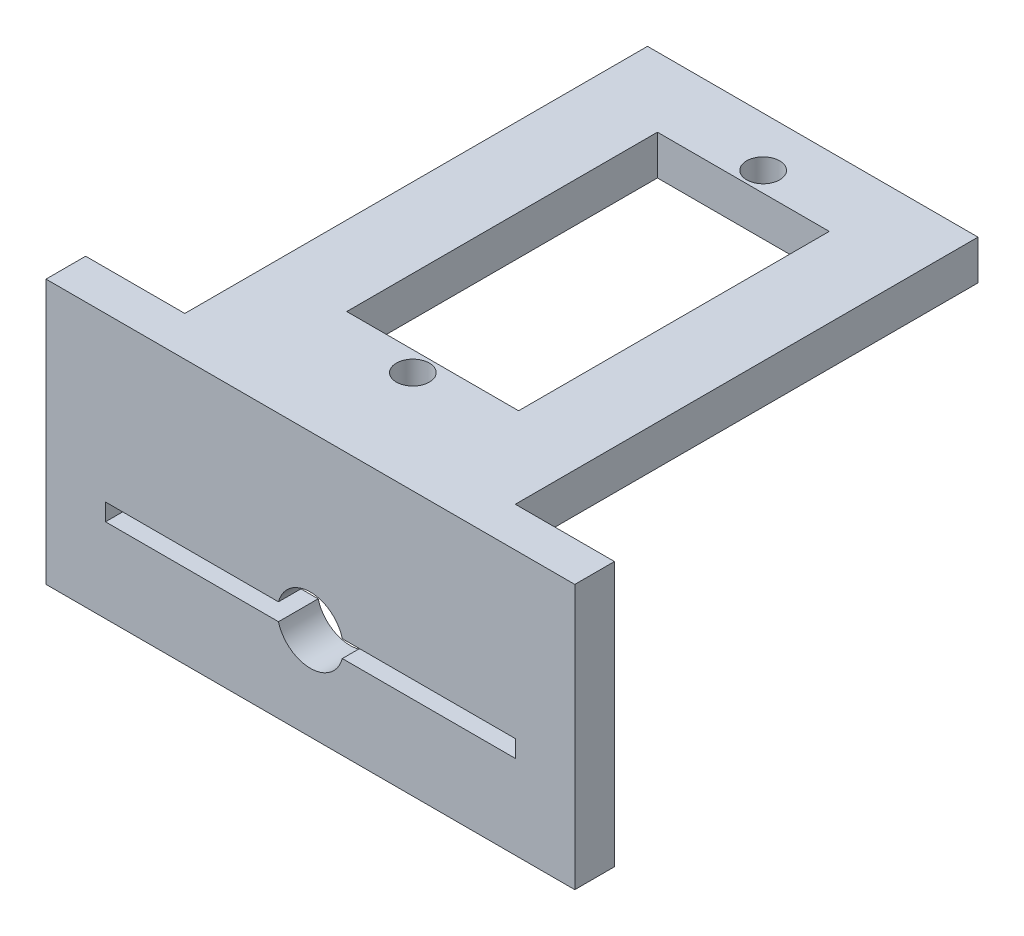
from build123d import *

# Parameters (mm, degrees)
ESBO_O1_W                         = 40
ESBO_O1_H                         = 20
RESSALTO_EXTRUS_O1_DEPTH          = 1
ESBO_O3_W                         = 40
ESBO_O3_H                         = 20
RESSALTO_EXTRUS_O2_DEPTH          = 2
CORTE_EXTRUS_O1_REACH             = 25.409
CORTE_EXTRUS_O1_DIRECTION_2_REACH = 25.409
ESBO_O4_W                         = 25
ESBO_O4_H                         = 35
ESBO_O4_R                         = 1.25
ESBO_O4_W_2                       = 13
ESBO_O4_H_2                       = 23.5
ESBO_O4_H_3                       = 3
RESSALTO_EXTRUS_O3_DEPTH          = 3
BODY_MOVE_COPY1_START             = 1
BODY_MOVE_COPY1_OUTLINE_W         = 40
BODY_MOVE_COPY1_OUTLINE_H         = 20
BODY_MOVE_COPY1_DEPTH             = 36
BODY_MOVE_COPY1_START_2           = -37
BODY_MOVE_COPY1_2_OUTLINE_W       = 6
BODY_MOVE_COPY1_2_OUTLINE_H       = 3
BODY_MOVE_COPY1_2_DEPTH           = 36
BODY_MOVE_COPY1_START_3           = -2
BODY_MOVE_COPY1_3_DEPTH           = 1
BODY_MOVE_COPY1_START_4           = -8.25
BODY_MOVE_COPY1_4_OUTLINE_W       = 13
BODY_MOVE_COPY1_4_OUTLINE_H       = 3
BODY_MOVE_COPY1_4_DEPTH           = 6.25
BODY_MOVE_COPY1_5_OUTLINE_W       = 13
BODY_MOVE_COPY1_5_OUTLINE_H       = 3
BODY_MOVE_COPY1_5_DEPTH           = 5.25
BODY_MOVE_COPY1_START_5           = 5
BODY_MOVE_COPY1_6_OUTLINE_R       = 1.25
BODY_MOVE_COPY1_6_DEPTH           = 3


with BuildPart() as part:
    # Esboço1 → Ressalto-extrusão1 (new body)
    with BuildSketch(Plane.XY):
        with Locations((0, -2)):
            Rectangle(ESBO_O1_W, ESBO_O1_H)
    extrude(amount=-RESSALTO_EXTRUS_O1_DEPTH)

    # Esboço3 → Ressalto-extrusão2 (add)
    with BuildSketch(Plane.XY):
        with Locations((0, -2)):
            Rectangle(ESBO_O3_W, ESBO_O3_H)
    extrude(amount=RESSALTO_EXTRUS_O2_DEPTH)

    # Corte-extrusão1: up to this face of the body (flat: up to its plane)
    corte_extrus_o1_end = Plane(part.part.faces().sort_by_distance((0, -2, 2))[0])
    # Esboço2 → Corte-extrusão1 (cut, up to the picked face)
    with BuildSketch(Plane.XY, mode=Mode.PRIVATE) as corte_extrus_o1_sk1:
        with BuildLine():
            Line((-2.414021541, -4.35), (-15.5, -4.35))
            Line((-15.5, -4.35), (-15.5, -5.65))
            Line((-15.5, -5.65), (-2.414021541, -5.65))
            ThreePointArc((-2.414021541, -5.65), (0, -7.5), (2.414021541, -5.65))
            Line((2.414021541, -5.65), (15.5, -5.65))
            Line((15.5, -5.65), (15.5, -4.35))
            Line((15.5, -4.35), (2.414021541, -4.35))
            ThreePointArc((2.414021541, -4.35), (0, -2.5), (-2.414021541, -4.35))
        make_face()
    corte_extrus_o1_tool1 = split(extrude(corte_extrus_o1_sk1.sketch, amount=CORTE_EXTRUS_O1_REACH, mode=Mode.PRIVATE), bisect_by=corte_extrus_o1_end, keep=Keep.BOTH, mode=Mode.PRIVATE)
    add(corte_extrus_o1_tool1.solids().sort_by(Axis((0, -5, 0), (0, 0, 1)))[0], mode=Mode.SUBTRACT)

    # Corte-extrusão1 direction 2: up to this face of the body (flat: up to its plane)
    corte_extrus_o1_direction_2_end = Plane(part.part.faces().sort_by_distance((0, -2, -1))[0])
    # Esboço2 → Corte-extrusão1 direction 2 (cut, up to the picked face)
    with BuildSketch(Plane.XY, mode=Mode.PRIVATE) as corte_extrus_o1_direction_2_sk1:
        with BuildLine():
            Line((-2.414021541, -4.35), (-15.5, -4.35))
            Line((-15.5, -4.35), (-15.5, -5.65))
            Line((-15.5, -5.65), (-2.414021541, -5.65))
            ThreePointArc((-2.414021541, -5.65), (0, -7.5), (2.414021541, -5.65))
            Line((2.414021541, -5.65), (15.5, -5.65))
            Line((15.5, -5.65), (15.5, -4.35))
            Line((15.5, -4.35), (2.414021541, -4.35))
            ThreePointArc((2.414021541, -4.35), (0, -2.5), (-2.414021541, -4.35))
        make_face()
    corte_extrus_o1_direction_2_tool1 = split(extrude(corte_extrus_o1_direction_2_sk1.sketch, amount=-CORTE_EXTRUS_O1_DIRECTION_2_REACH, mode=Mode.PRIVATE), bisect_by=corte_extrus_o1_direction_2_end, keep=Keep.BOTH, mode=Mode.PRIVATE)
    add(corte_extrus_o1_direction_2_tool1.solids().sort_by(Axis((0, -5, 0), (0, 0, -1)))[0], mode=Mode.SUBTRACT)

    # Esboço4 → Ressalto-extrusão3 (add)
    # profile 1 of 2: a face of its own
    with BuildSketch(Plane(origin=(0, 8, 0), x_dir=(1, 0, 0), z_dir=(0, 1, 0))):
        with Locations((0, -19.5)):
            Rectangle(ESBO_O4_W, ESBO_O4_H)
        with Locations(Location((0, -33.25, 0), (0, 0, 180))):
            Circle(ESBO_O4_R, mode=Mode.SUBTRACT)
        with Locations((0, -20)):
            Rectangle(ESBO_O4_W_2, ESBO_O4_H_2, mode=Mode.SUBTRACT)
        with Locations(Location((0, -6.75, 0), (0, 0, 180))):
            Circle(ESBO_O4_R, mode=Mode.SUBTRACT)
    # profile 2 of 2: a face of its own
    with BuildSketch(Plane(origin=(0, 8, 0), x_dir=(1, 0, 0), z_dir=(0, 1, 0))):
        with Locations((0, -0.5)):
            Rectangle(ESBO_O4_W, ESBO_O4_H_3)
    extrude(amount=-RESSALTO_EXTRUS_O3_DEPTH)

    # Body-Move/Copy1: read off the stored shape, not the designer's step
    # Body-Move/Copy1 outline → Body-Move/Copy1 (cut)
    with BuildSketch(Plane.XY.offset(BODY_MOVE_COPY1_START)):
        with Locations((0, -2)):
            Rectangle(BODY_MOVE_COPY1_OUTLINE_W, BODY_MOVE_COPY1_OUTLINE_H)
        with BuildLine():
            ThreePointArc((-2.414021541, -4.35), (0, -2.5), (2.414021541, -4.35))
            Line((2.414021541, -4.35), (15.5, -4.35))
            Line((15.5, -4.35), (15.5, -5.65))
            Line((15.5, -5.65), (2.414021541, -5.65))
            ThreePointArc((2.414021541, -5.65), (0, -7.5), (-2.414021541, -5.65))
            Line((-2.414021541, -5.65), (-15.5, -5.65))
            Line((-15.5, -5.65), (-15.5, -4.35))
            Line((-15.5, -4.35), (-2.414021541, -4.35))
        make_face(mode=Mode.SUBTRACT)
    extrude(amount=BODY_MOVE_COPY1_DEPTH, mode=Mode.SUBTRACT)

    # Body-Move_Copy1 2 outline → Body-Move_Copy1 2 (add)
    with BuildSketch(Plane.XY.offset(BODY_MOVE_COPY1_START_2)):
        with Locations((-9.5, 6.5)):
            Rectangle(BODY_MOVE_COPY1_2_OUTLINE_W, BODY_MOVE_COPY1_2_OUTLINE_H)
        with Locations((9.5, 6.5)):
            Rectangle(BODY_MOVE_COPY1_2_OUTLINE_W, BODY_MOVE_COPY1_2_OUTLINE_H)
    extrude(amount=BODY_MOVE_COPY1_2_DEPTH)

    # Body-Move_Copy1 3 outline → Body-Move_Copy1 3 (add)
    with BuildSketch(Plane.XY.offset(BODY_MOVE_COPY1_START_3)):
        Polygon((-20, 8), (-20, -12), (20, -12), (20, 8), (12.5, 8), (12.5, 5), (6.5, 5), (6.5, 8), (-6.5, 8), (-6.5, 5), (-12.5, 5), (-12.5, 8), align=None)
        with BuildLine():
            ThreePointArc((-2.414021541, -4.35), (0, -2.5), (2.414021541, -4.35))
            Line((2.414021541, -4.35), (15.5, -4.35))
            Line((15.5, -4.35), (15.5, -5.65))
            Line((15.5, -5.65), (2.414021541, -5.65))
            ThreePointArc((2.414021541, -5.65), (0, -7.5), (-2.414021541, -5.65))
            Line((-2.414021541, -5.65), (-15.5, -5.65))
            Line((-15.5, -5.65), (-15.5, -4.35))
            Line((-15.5, -4.35), (-2.414021541, -4.35))
        make_face(mode=Mode.SUBTRACT)
    extrude(amount=BODY_MOVE_COPY1_3_DEPTH)

    # Body-Move_Copy1 4 outline → Body-Move_Copy1 4 (add)
    with BuildSketch(Plane.XY.offset(BODY_MOVE_COPY1_START_4)):
        with Locations((0, 6.5)):
            Rectangle(BODY_MOVE_COPY1_4_OUTLINE_W, BODY_MOVE_COPY1_4_OUTLINE_H)
    extrude(amount=BODY_MOVE_COPY1_4_DEPTH)

    # Body-Move_Copy1 5 outline → Body-Move_Copy1 5 (add)
    with BuildSketch(Plane.XY.offset(BODY_MOVE_COPY1_START_2)):
        with Locations((0, 6.5)):
            Rectangle(BODY_MOVE_COPY1_5_OUTLINE_W, BODY_MOVE_COPY1_5_OUTLINE_H)
    extrude(amount=BODY_MOVE_COPY1_5_DEPTH)

    # Body-Move_Copy1 6 outline → Body-Move_Copy1 6 (cut)
    with BuildSketch(Plane(origin=(0, 0, 0), x_dir=(1, 0, 0), z_dir=(0, 1, 0)).offset(BODY_MOVE_COPY1_START_5)):
        with Locations((0, 6.75)):
            Circle(BODY_MOVE_COPY1_6_OUTLINE_R)
        with Locations((0, 33.25)):
            Circle(BODY_MOVE_COPY1_6_OUTLINE_R)
    extrude(amount=BODY_MOVE_COPY1_6_DEPTH, mode=Mode.SUBTRACT)


solid = part.part
